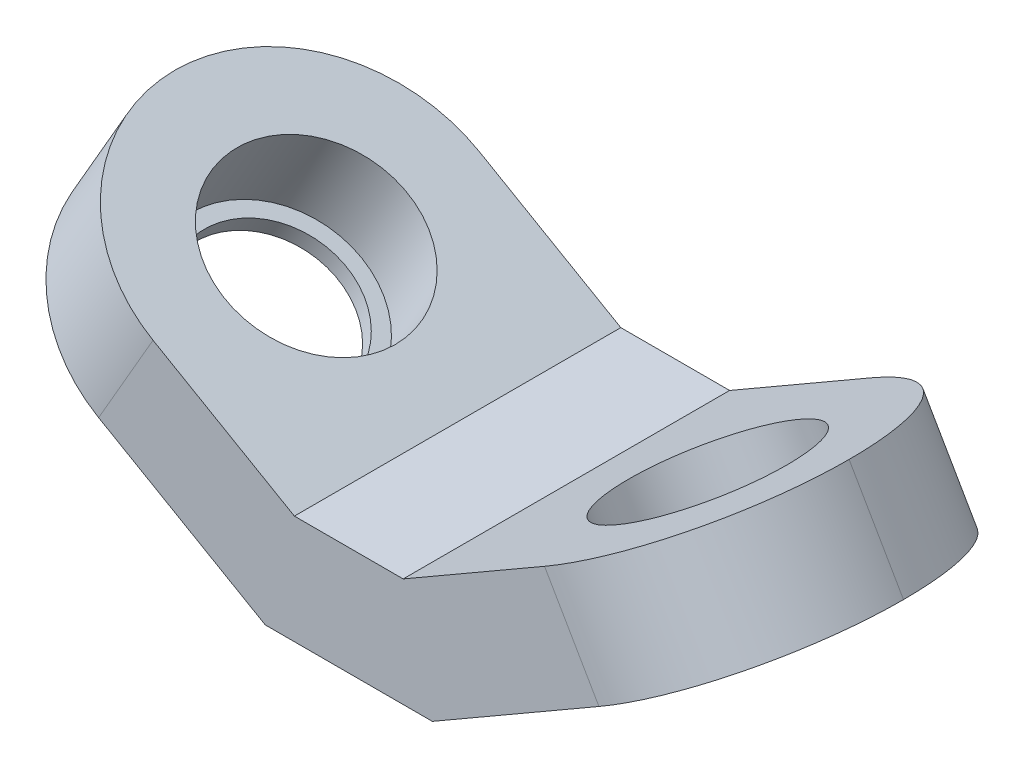
from build123d import *

# Parameters (mm, degrees)
EXTRUDE_1_DEPTH          = 7.5
CUT_EXTRUDE_1_DEPTH      = 27.249846584
CUT_EXTRUDE_1_DEPTH_BACK = 27.249846584
SKETCH_2_R               = 4.2
CUT_EXTRUDE_2_DEPTH      = 27.516200545
CUT_EXTRUDE_2_DEPTH_BACK = 27.516200545
SKETCH_3_R               = 4.2
FILLET_1_R               = 7.5
SKETCH_4_R               = 4.2
SKETCH_4_R_2             = 3.5
EXTRUDE_2_DEPTH          = 0.8
SKETCH_5_R               = 4.2
SKETCH_5_R_2             = 3.5
EXTRUDE_3_DEPTH          = 0.8


with BuildPart() as part:
    # ｽｹｯﾁ1 → ﾎﾞｽ - 押し出し1 (new, symmetric)
    with BuildSketch(Plane.XY):
        Polygon((0, 0), (-14.150635095, 8.169872981), (-11.650635095, 12.5), (1.339745962, 5), (6.339745962, 5), (19.330127019, 12.5), (21.830127019, 8.169872981), (7.679491924, 0), align=None)
    extrude(amount=EXTRUDE_1_DEPTH, both=True)

    # ｽｹｯﾁ2 → ｶｯﾄ - 押し出し1 (cut, two sides: drawn at the far end of the back side and taken through both)
    with BuildSketch(Plane(origin=(0, 0, 0), x_dir=(0, 0, 1), z_dir=(-0.5000000000000012, -0.866025403784438, 0)).offset(-CUT_EXTRUDE_1_DEPTH_BACK)):
        with Locations(Location((0, 8.839745962, 0), (0, 0, 270))):
            Circle(SKETCH_2_R)
    extrude(amount=CUT_EXTRUDE_1_DEPTH + CUT_EXTRUDE_1_DEPTH_BACK, mode=Mode.SUBTRACT)

    # ｽｹｯﾁ3 → ｶｯﾄ - 押し出し2 (cut, two sides: drawn at the far end of the back side and taken through both)
    with BuildSketch(Plane(origin=(1.919872981, -3.325317547, 0), x_dir=(0, 0, -1), z_dir=(0.5000000000000013, -0.8660254037844379, 0)).offset(-CUT_EXTRUDE_2_DEPTH_BACK)):
        with Locations(Location((0, 15.490381057, 0), (0, 0, 90))):
            Circle(SKETCH_3_R)
    extrude(amount=CUT_EXTRUDE_2_DEPTH + CUT_EXTRUDE_2_DEPTH_BACK, mode=Mode.SUBTRACT)

    # ﾌｨﾚｯﾄ1
    fillet_1_edges = [part.edges().sort_by_distance(p)[0] for p in [
        (20.580127019, 10.334936491, -7.5),
        (20.580127019, 10.334936491, 7.5),
        (-12.900635095, 10.334936491, -7.5),
        (-12.900635095, 10.334936491, 7.5),
    ]]
    fillet(fillet_1_edges, radius=FILLET_1_R - 0.0001)  # a hair under: the kernel refuses the full size

    # ｽｹｯﾁ4 → ﾎﾞｽ - 押し出し2 (add)
    with BuildSketch(Plane(origin=(0, 0, 0), x_dir=(0.8660254037844382, -0.500000000000001, 0), z_dir=(0.5000000000000009, 0.866025403784438, 0))):
        with Locations((-8.839745962, 0)):
            Circle(SKETCH_4_R)
        with Locations((-8.839745962, 0)):
            Circle(SKETCH_4_R_2, mode=Mode.SUBTRACT)
    extrude(amount=EXTRUDE_2_DEPTH)

    # ｽｹｯﾁ5 → ﾎﾞｽ - 押し出し3 (add)
    with BuildSketch(Plane(origin=(1.919872981, -3.325317547, 0), x_dir=(0.8660254037844378, 0.5000000000000017, 0), z_dir=(-0.5000000000000016, 0.8660254037844377, 0))):
        with Locations((15.490381057, 0)):
            Circle(SKETCH_5_R)
        with Locations((15.490381057, 0)):
            Circle(SKETCH_5_R_2, mode=Mode.SUBTRACT)
    extrude(amount=EXTRUDE_3_DEPTH)


solid = part.part
